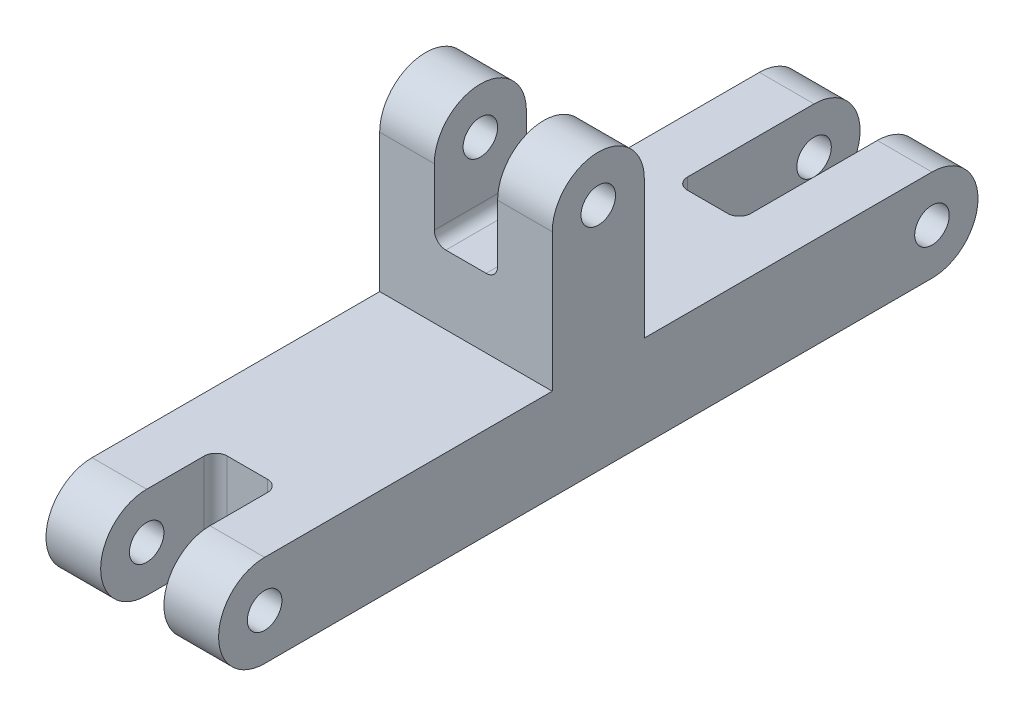
from build123d import *

# Parameters (mm, degrees)
CROQUIS1_R              = 1.5
SALIENTE_EXTRUIR1_DEPTH = 7.5
CROQUIS2_W              = 8
CROQUIS2_H              = 10
CROQUIS2_W_2            = 16
CROQUIS2_H_2            = 8
CROQUIS2_W_3            = 10
CORTAR_EXTRUIR1_DEPTH   = 2.75
REDONDEO1_R             = 1


with BuildPart() as part:
    # Croquis1 → Saliente-Extruir1 (new, symmetric)
    with BuildSketch(Plane(origin=(0, 0, 0), x_dir=(0, 0, -1), z_dir=(1, 0, 0))):
        with BuildLine():
            Line((-15, -4), (15, -4))
            ThreePointArc((15, -4), (19, 0), (15, 4))
            Line((15, 4), (-10, 4))
            Line((-10, 4), (-10, 16))
            ThreePointArc((-10, 16), (-14, 20), (-18, 16))
            Line((-18, 16), (-18, 4))
            Line((-18, 4), (-43, 4))
            ThreePointArc((-43, 4), (-47, 0), (-43, -4))
            Line((-43, -4), (-15, -4))
        make_face()
        with Locations((15, 0)):
            Circle(CROQUIS1_R, mode=Mode.SUBTRACT)
        with Locations((-14, 16)):
            Circle(CROQUIS1_R, mode=Mode.SUBTRACT)
        with Locations((-43, 0)):
            Circle(CROQUIS1_R, mode=Mode.SUBTRACT)
    extrude(amount=SALIENTE_EXTRUIR1_DEPTH, both=True)

    # Croquis2 → Cortar-Extruir1 (cut, symmetric)
    with BuildSketch(Plane(origin=(0, 0, 0), x_dir=(0, 0, -1), z_dir=(1, 0, 0))):
        with Locations((-14, 15)):
            Rectangle(CROQUIS2_W, CROQUIS2_H)
        with Locations((11, 0)):
            Rectangle(CROQUIS2_W_2, CROQUIS2_H_2)
        with Locations((-42, 0)):
            Rectangle(CROQUIS2_W_3, CROQUIS2_H_2)
    extrude(amount=CORTAR_EXTRUIR1_DEPTH, both=True, mode=Mode.SUBTRACT)

    # Redondeo1
    redondeo1_edges = [part.edges().sort_by_distance(p)[0] for p in [
        (2.75, 0, 37),
        (-2.75, 0, 37),
        (2.75, 0, -3),
        (-2.75, 0, -3),
        (2.75, 10, 14),
        (-2.75, 10, 14),
    ]]
    fillet(redondeo1_edges, radius=REDONDEO1_R)


solid = part.part
